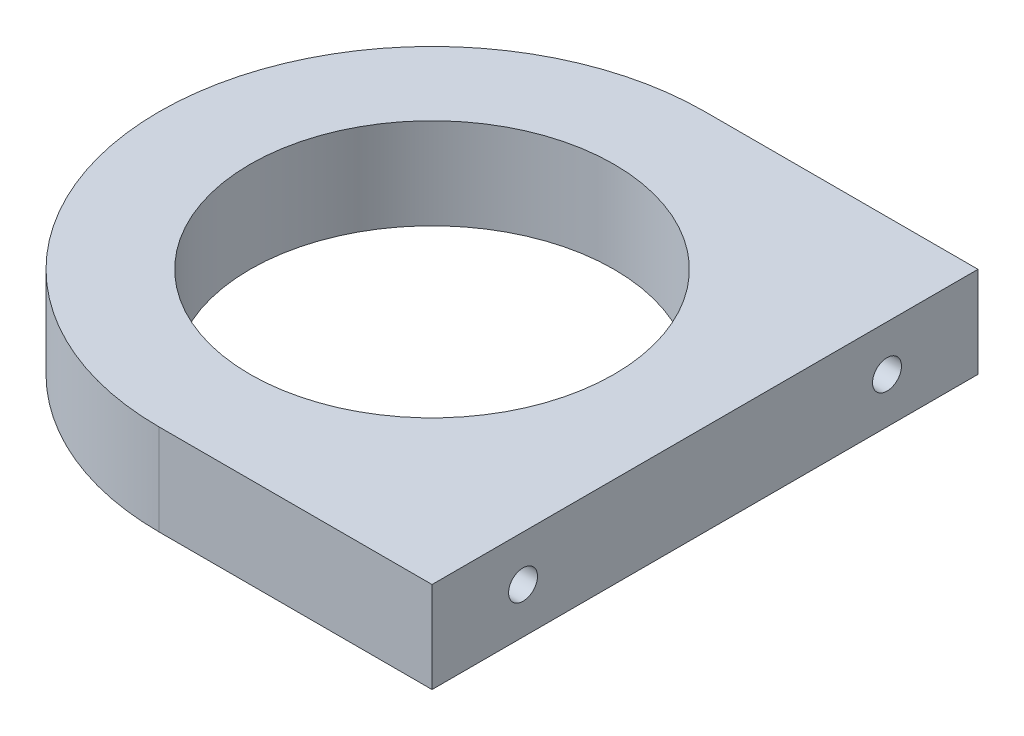
from build123d import *

# Parameters (mm, degrees)
SKETCH1_W                  = 76.2
SKETCH1_H                  = 76.2
BOSS_EXTRUDE1_DEPTH        = 12.7
F_10_32_TAPPED_HOLE1_D     = 4.0386
F_10_32_TAPPED_HOLE1_DEPTH = 9.652
F_10_32_TAPPED_HOLE1_TIP   = 1.213317848
SKETCH9_R                  = 25.4
CUT_EXTRUDE2_DEPTH         = 56.358016583
FILLET1_R                  = 38.1


with BuildPart() as part:
    # Sketch1 → Boss-Extrude1 (new body)
    with BuildSketch(Plane(origin=(0, 0, 0), x_dir=(1, 0, 0), z_dir=(0, 1, 0))):
        Rectangle(SKETCH1_W, SKETCH1_H)
    extrude(amount=BOSS_EXTRUDE1_DEPTH)

    # #10-32 Tapped Hole1
    with Locations(Plane(origin=(38.1, 0, 0), x_dir=(0, 0, -1), z_dir=(1, 0, 0))):
        with Locations((-25.4, 6.35), (25.4, 6.35)):
            Hole(F_10_32_TAPPED_HOLE1_D / 2, depth=F_10_32_TAPPED_HOLE1_DEPTH)
            with Locations((0, 0, -(F_10_32_TAPPED_HOLE1_DEPTH + F_10_32_TAPPED_HOLE1_TIP / 2))):  # 118° drill point
                Cone(0, F_10_32_TAPPED_HOLE1_D / 2, F_10_32_TAPPED_HOLE1_TIP, mode=Mode.SUBTRACT)

    # Sketch9 → Cut-Extrude2 (cut, through all)
    with BuildSketch(Plane(origin=(0, 12.7, 0), x_dir=(1, 0, 0), z_dir=(0, 1, 0))):
        with Locations(Location((0, 0, 0), (0, 0, 270))):
            Circle(SKETCH9_R)
    extrude(amount=-CUT_EXTRUDE2_DEPTH, mode=Mode.SUBTRACT)

    # Fillet1
    fillet1_edges = [part.edges().sort_by_distance(p)[0] for p in [
        (-38.1, 6.35, -38.1),
        (-38.1, 6.35, 38.1),
    ]]
    fillet(fillet1_edges, radius=FILLET1_R - 0.0001)  # a hair under: the kernel refuses the full size


solid = part.part
